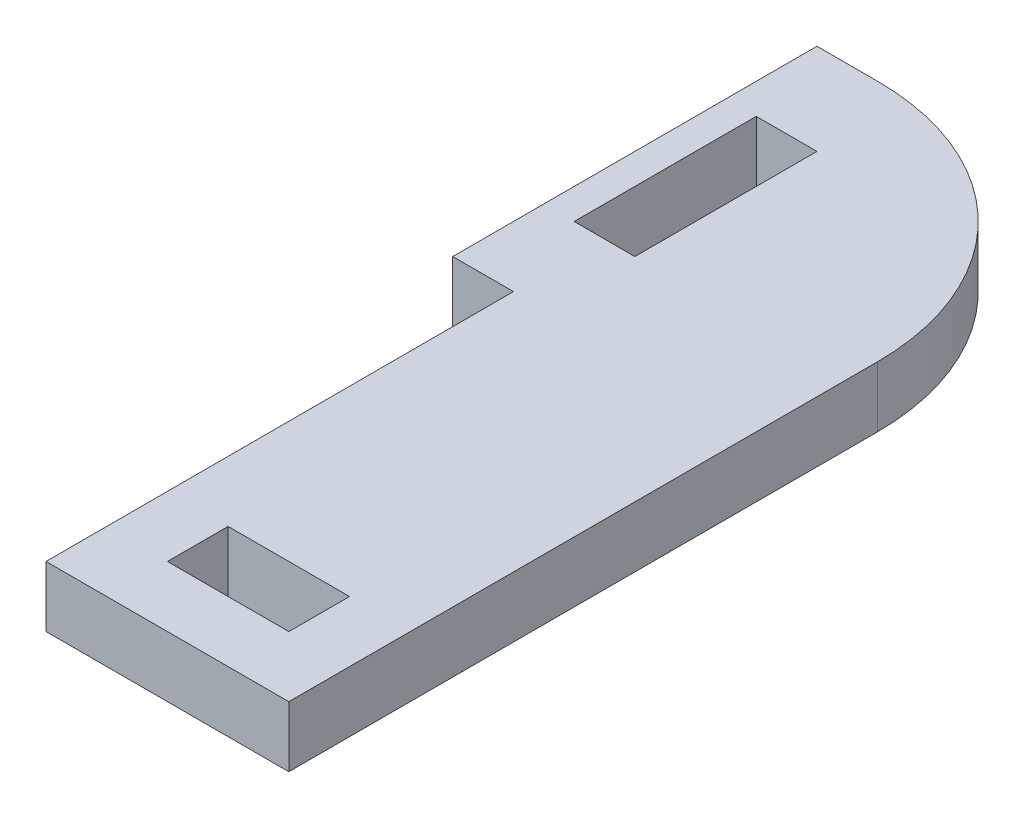
from build123d import *

# Parameters (mm, degrees)
SKETCH1_W           = 10
SKETCH1_H           = 5
SKETCH1_W_2         = 5
SKETCH1_H_2         = 15
BOSS_EXTRUDE1_DEPTH = 5
FILLET2_R           = 20


with BuildPart() as part:
    # Sketch1 → Boss-Extrude1 (new body)
    with BuildSketch(Plane(origin=(0, 0, 0), x_dir=(1, 0, 0), z_dir=(0, 1, 0))):
        Polygon((-30.064538889, 111.027213551), (-25.064538889, 111.027213551), (-25.064538889, 72.527213551), (-5.064538889, 72.527213551), (-5.064538889, 141.027213551), (-30.064538889, 141.027213551), align=None)
        with Locations((-15.064538889, 80.027213551)):
            Rectangle(SKETCH1_W, SKETCH1_H, mode=Mode.SUBTRACT)
        with Locations((-25.064538889, 126.027213551)):
            Rectangle(SKETCH1_W_2, SKETCH1_H_2, mode=Mode.SUBTRACT)
    extrude(amount=BOSS_EXTRUDE1_DEPTH)

    # Fillet2
    fillet2_edges = [part.edges().sort_by_distance(p)[0] for p in [
        (-5.064538889, 2.5, -141.027213551),
    ]]
    fillet(fillet2_edges, radius=FILLET2_R)


solid = part.part
